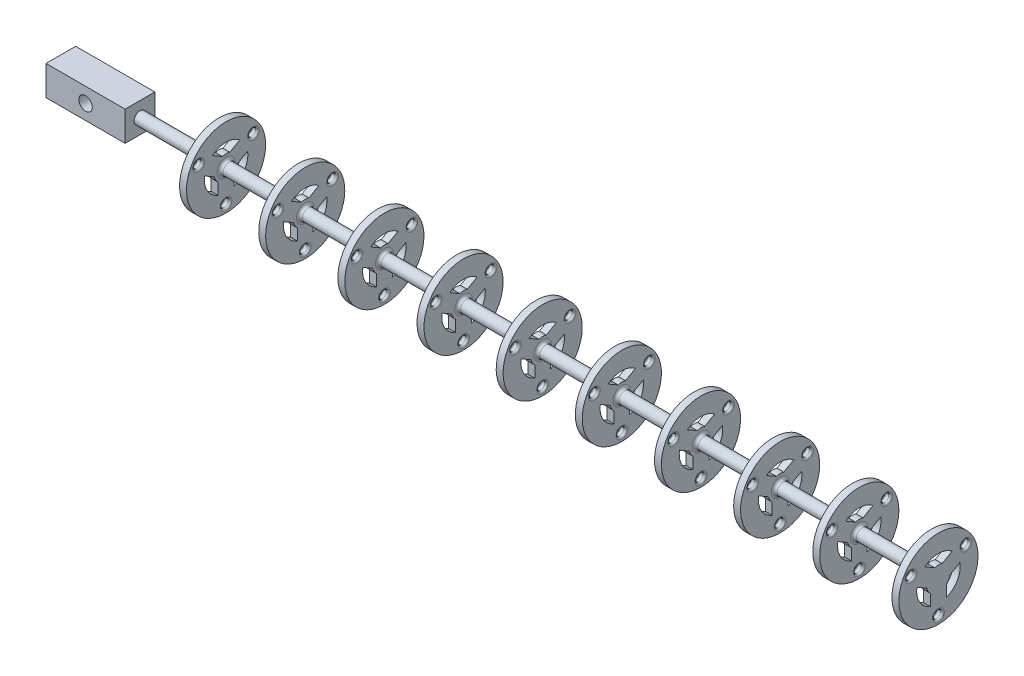
from build123d import *

# Parameters (mm, degrees)
SKETCH2_W                      = 200
SKETCH2_H                      = 1.5
SKETCH3_W                      = 1.75
SKETCH3_H                      = 10
CUT_EXTRUDE1_REACH             = 180.81
SKETCH5_R                      = 1
FILLET1_R                      = 0.5
LPATTERN1_COUNT                = 10
LPATTERN1_PITCH                = 20
FILLET1_OF_LPATTERN1_R         = 0.5
SKETCH16_W                     = 7.5
SKETCH16_H                     = 7.5
BOSS_EXTRUDE1_DEPTH            = 20
M3_CLEARANCE_HOLE1_D           = 3.4
M3_CLEARANCE_HOLE1_CSINK_D     = 3.45
M3_CLEARANCE_HOLE1_CSINK_ANGLE = 90
FILLET2_R                      = 0.75


with BuildPart() as part:
    # Sketch2 → Revolve1 (revolve)
    with BuildSketch(Plane.XY):
        with Locations((100, 0.75)):
            Rectangle(SKETCH2_W, SKETCH2_H)
    revolve(axis=Axis((200, 0, 0), (-1, 0, 0)))

    # Sketch3 → Revolve2 (revolve)
    with BuildSketch(Plane.XY):
        with Locations((20.875, 5)):
            Rectangle(SKETCH3_W, SKETCH3_H)
    revolve2 = revolve(axis=Axis((21.75, 0, 0), (-1, 0, 0)))

    # Sketch5 → Cut-Extrude1 (cut, up to next)
    with BuildSketch(Plane(origin=(21.75, 0, 0), x_dir=(0, 0, -1), z_dir=(1, 0, 0)), mode=Mode.PRIVATE) as cut_extrude1_sk1:
        with Locations((0, -8)):
            Circle(SKETCH5_R)
    cut_extrude1_tool1 = extrude(cut_extrude1_sk1.sketch, amount=-CUT_EXTRUDE1_REACH, mode=Mode.PRIVATE) & part.part
    # Sketch5 → Cut-Extrude1 (cut, up to next)
    with BuildSketch(Plane(origin=(21.75, 0, 0), x_dir=(0, 0, -1), z_dir=(1, 0, 0)), mode=Mode.PRIVATE) as cut_extrude1_sk2:
        with Locations((6.92820323, 4)):
            Circle(SKETCH5_R)
    cut_extrude1_tool2 = extrude(cut_extrude1_sk2.sketch, amount=-CUT_EXTRUDE1_REACH, mode=Mode.PRIVATE) & part.part
    # Sketch5 → Cut-Extrude1 (cut, up to next)
    with BuildSketch(Plane(origin=(21.75, 0, 0), x_dir=(0, 0, -1), z_dir=(1, 0, 0)), mode=Mode.PRIVATE) as cut_extrude1_sk3:
        with Locations((-6.92820323, 4)):
            Circle(SKETCH5_R)
    cut_extrude1_tool3 = extrude(cut_extrude1_sk3.sketch, amount=-CUT_EXTRUDE1_REACH, mode=Mode.PRIVATE) & part.part
    # Sketch5 → Cut-Extrude1 (cut, up to next)
    with BuildSketch(Plane(origin=(21.75, 0, 0), x_dir=(0, 0, -1), z_dir=(1, 0, 0)), mode=Mode.PRIVATE) as cut_extrude1_sk4:
        with BuildLine():
            Line((-3.437059837, 4.293788499), (-0.936491673, 2.850084796))
            ThreePointArc((-0.936491673, 2.850084796), (0, 3), (0.936491673, 2.850084796))
            Line((0.936491673, 2.850084796), (3.437059837, 4.293788499))
            ThreePointArc((3.437059837, 4.293788499), (0, 5.5), (-3.437059837, 4.293788499))
        make_face()
    cut_extrude1_tool4 = extrude(cut_extrude1_sk4.sketch, amount=-CUT_EXTRUDE1_REACH, mode=Mode.PRIVATE) & part.part
    # Sketch5 → Cut-Extrude1 (cut, up to next)
    with BuildSketch(Plane(origin=(21.75, 0, 0), x_dir=(0, 0, -1), z_dir=(1, 0, 0)), mode=Mode.PRIVATE) as cut_extrude1_sk5:
        with BuildLine():
            Line((2, -2.236067977), (2, -5.123475383))
            ThreePointArc((2, -5.123475383), (4.763139721, -2.75), (5.437059837, 0.829686884))
            Line((5.437059837, 0.829686884), (2.936491673, -0.614016819))
            ThreePointArc((2.936491673, -0.614016819), (2.598076211, -1.5), (2, -2.236067977))
        make_face()
    cut_extrude1_tool5 = extrude(cut_extrude1_sk5.sketch, amount=-CUT_EXTRUDE1_REACH, mode=Mode.PRIVATE) & part.part
    # Sketch5 → Cut-Extrude1 (cut, up to next)
    with BuildSketch(Plane(origin=(21.75, 0, 0), x_dir=(0, 0, -1), z_dir=(1, 0, 0)), mode=Mode.PRIVATE) as cut_extrude1_sk6:
        with BuildLine():
            Line((-2.936491673, -0.614016819), (-5.437059837, 0.829686884))
            ThreePointArc((-5.437059837, 0.829686884), (-4.763139721, -2.75), (-2, -5.123475383))
            Line((-2, -5.123475383), (-2, -2.236067977))
            ThreePointArc((-2, -2.236067977), (-2.598076211, -1.5), (-2.936491673, -0.614016819))
        make_face()
    cut_extrude1_tool6 = extrude(cut_extrude1_sk6.sketch, amount=-CUT_EXTRUDE1_REACH, mode=Mode.PRIVATE) & part.part
    cut_extrude1_1 = cut_extrude1_tool1.solids().sort_by_distance((21.75, -8, 0))[0]
    add(cut_extrude1_1, mode=Mode.SUBTRACT)
    cut_extrude1_2 = cut_extrude1_tool2.solids().sort_by_distance((21.75, 4, -6.928203))[0]
    add(cut_extrude1_2, mode=Mode.SUBTRACT)
    cut_extrude1_3 = cut_extrude1_tool3.solids().sort_by_distance((21.75, 4, 6.928203))[0]
    add(cut_extrude1_3, mode=Mode.SUBTRACT)
    cut_extrude1_4 = cut_extrude1_tool4.solids().sort_by_distance((21.75, 4.236965, 0))[0]
    add(cut_extrude1_4, mode=Mode.SUBTRACT)
    cut_extrude1_5 = cut_extrude1_tool5.solids().sort_by_distance((21.75, -2.118482, -3.669319))[0]
    add(cut_extrude1_5, mode=Mode.SUBTRACT)
    cut_extrude1_6 = cut_extrude1_tool6.solids().sort_by_distance((21.75, -2.118482, 3.669319))[0]
    add(cut_extrude1_6, mode=Mode.SUBTRACT)
    cut_extrude1 = cut_extrude1_1 + cut_extrude1_2 + cut_extrude1_3 + cut_extrude1_4 + cut_extrude1_5 + cut_extrude1_6  # Cut-Extrude1 as one shape, for the pattern or mirror that repeats it

    # Fillet1
    fillet1_edges = [part.edges().sort_by_distance(p)[0] for p in [
        (20, 4, -5.92820323),
        (20, -8, 1),
        (21.75, -8, 1),
        (21.75, 4, -5.92820323),
        (20, 4, 7.92820323),
        (21.75, 4, 7.92820323),
    ]]
    fillet(fillet1_edges, radius=FILLET1_R)

    # LPattern1: Revolve2, Cut-Extrude1 ×10
    with Locations(*[(i * LPATTERN1_PITCH, 0, 0) for i in range(1, LPATTERN1_COUNT)]):
        add(revolve2)
        add(cut_extrude1, mode=Mode.SUBTRACT)

    # Fillet1 of LPattern1
    fillet1_of_lpattern1_edges = [part.edges().sort_by_distance(p)[0] for p in [
        (40, 4, -5.92820323),
        (40, -8, 1),
        (41.75, -8, 1),
        (41.75, 4, -5.92820323),
        (40, 4, 7.92820323),
        (41.75, 4, 7.92820323),
        (60, 4, -5.92820323),
        (60, -8, 1),
        (61.75, -8, 1),
        (61.75, 4, -5.92820323),
        (60, 4, 7.92820323),
        (61.75, 4, 7.92820323),
        (80, 4, -5.92820323),
        (80, -8, 1),
        (81.75, -8, 1),
        (81.75, 4, -5.92820323),
        (80, 4, 7.92820323),
        (81.75, 4, 7.92820323),
        (100, 4, -5.92820323),
        (100, -8, 1),
        (101.75, -8, 1),
        (101.75, 4, -5.92820323),
        (100, 4, 7.92820323),
        (101.75, 4, 7.92820323),
        (120, 4, -5.92820323),
        (120, -8, 1),
        (121.75, -8, 1),
        (121.75, 4, -5.92820323),
        (120, 4, 7.92820323),
        (121.75, 4, 7.92820323),
        (140, 4, -5.92820323),
        (140, -8, 1),
        (141.75, -8, 1),
        (141.75, 4, -5.92820323),
        (140, 4, 7.92820323),
        (141.75, 4, 7.92820323),
        (160, 4, -5.92820323),
        (160, -8, 1),
        (161.75, -8, 1),
        (161.75, 4, -5.92820323),
        (160, 4, 7.92820323),
        (161.75, 4, 7.92820323),
        (180, 4, -5.92820323),
        (180, -8, 1),
        (181.75, -8, 1),
        (181.75, 4, -5.92820323),
        (180, 4, 7.92820323),
        (181.75, 4, 7.92820323),
        (200, 4, -5.92820323),
        (200, -8, 1),
        (201.75, -8, 1),
        (201.75, 4, -5.92820323),
        (200, 4, 7.92820323),
        (201.75, 4, 7.92820323),
    ]]
    fillet(fillet1_of_lpattern1_edges, radius=FILLET1_OF_LPATTERN1_R)

    # Sketch16 → Boss-Extrude1 (add)
    with BuildSketch(Plane.ZY):
        Rectangle(SKETCH16_W, SKETCH16_H)
    extrude(amount=BOSS_EXTRUDE1_DEPTH)

    # M3 Clearance Hole1 (through all)
    with Locations(Plane(origin=(0, 0, -3.75), x_dir=(-1, 0, 0), z_dir=(0, 0, -1))):
        with Locations((10, 0)):
            CounterSinkHole(M3_CLEARANCE_HOLE1_D / 2, M3_CLEARANCE_HOLE1_CSINK_D / 2, counter_sink_angle=M3_CLEARANCE_HOLE1_CSINK_ANGLE)

    # Fillet2
    fillet2_edges = [part.edges().sort_by_distance(p)[0] for p in [
        (20, -1.5, 0),
        (21.75, -1.5, 0),
        (40, -1.5, 0),
        (41.75, -1.5, 0),
        (60, -1.5, 0),
        (61.75, -1.5, 0),
        (80, -1.5, 0),
        (81.75, -1.5, 0),
        (100, -1.5, 0),
        (101.75, -1.5, 0),
        (120, -1.5, 0),
        (121.75, -1.5, 0),
        (140, -1.5, 0),
        (141.75, -1.5, 0),
        (160, -1.5, 0),
        (161.75, -1.5, 0),
        (180, -1.5, 0),
        (181.75, -1.5, 0),
        (200, -1.5, 0),
    ]]
    fillet(fillet2_edges, radius=FILLET2_R)


solid = part.part
